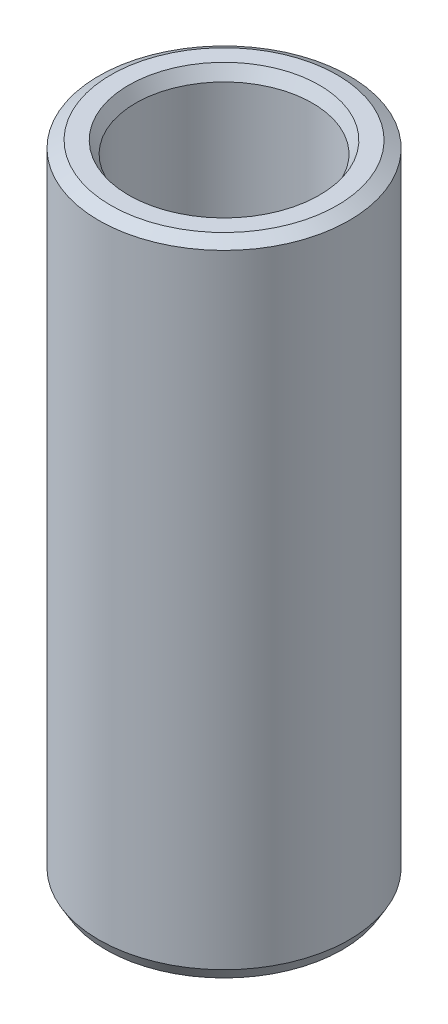
from build123d import *
from OCP.BRepFilletAPI import BRepFilletAPI_MakeChamfer

# Parameters (mm, degrees)
SKETCH1_R           = 45
BOSS_EXTRUDE1_DEPTH = 230.687205586
SKETCH2_R           = 31.759834781
CUT_EXTRUDE1_DEPTH  = 240.304381116
CHAMFER1_SIZE       = 2.504904957
CHAMFER1_SIZE2      = 4.338622654


with BuildPart() as part:
    # Sketch1 → Boss-Extrude1 (new body)
    with BuildSketch(Plane(origin=(0, 0, 0), x_dir=(1, 0, 0), z_dir=(0, 1, 0))):
        Circle(SKETCH1_R)
    extrude(amount=BOSS_EXTRUDE1_DEPTH)

    # Sketch2 → Cut-Extrude1 (cut, through all)
    with BuildSketch(Plane(origin=(0, 0, 0), x_dir=(1, 0, 0), z_dir=(0, 1, 0))):
        Circle(SKETCH2_R)
    extrude(amount=CUT_EXTRUDE1_DEPTH, mode=Mode.SUBTRACT)

    # Chamfer1: one chamfer whose edges measure the first distance from different faces: ONE call of the kernel's chamfer builder (chamfer() names one face for all edges)
    chamfer1_edges_1 = [part.edges().sort_by_distance(p)[0] for p in [
        (-31.759834781, 230.687205586, 0),
    ]]
    chamfer1_side_1 = [part.faces().sort_by_distance(p)[0] for p in [
        (-43.727207794, 230.687205586, 0),
    ]]
    chamfer1_edges_2 = [part.edges().sort_by_distance(p)[0] for p in [
        (-31.759834781, 0, 0),
    ]]
    chamfer1_side_2 = [part.faces().sort_by_distance(p)[0] for p in [
        (-31.759834781, 115.343602793, 0),
    ]]
    chamfer1_edges_3 = [part.edges().sort_by_distance(p)[0] for p in [
        (-45, 0, 0),
    ]]
    chamfer1_side_3 = [part.faces().sort_by_distance(p)[0] for p in [
        (-43.727207794, 0, 0),
    ]]
    chamfer1_edges_4 = [part.edges().sort_by_distance(p)[0] for p in [
        (-45, 230.687205586, 0),
    ]]
    chamfer1_side_4 = [part.faces().sort_by_distance(p)[0] for p in [
        (-45, 115.343602793, 0),
    ]]
    chamfer1 = BRepFilletAPI_MakeChamfer(part.part.solid().wrapped)
    for e in chamfer1_edges_1:
        chamfer1.Add(CHAMFER1_SIZE, CHAMFER1_SIZE2, e.wrapped, chamfer1_side_1[0].wrapped)  # the first distance lies on this face
    for e in chamfer1_edges_2:
        chamfer1.Add(CHAMFER1_SIZE, CHAMFER1_SIZE2, e.wrapped, chamfer1_side_2[0].wrapped)  # the first distance lies on this face
    for e in chamfer1_edges_3:
        chamfer1.Add(CHAMFER1_SIZE, CHAMFER1_SIZE2, e.wrapped, chamfer1_side_3[0].wrapped)  # the first distance lies on this face
    for e in chamfer1_edges_4:
        chamfer1.Add(CHAMFER1_SIZE, CHAMFER1_SIZE2, e.wrapped, chamfer1_side_4[0].wrapped)  # the first distance lies on this face
    add(Compound.cast(chamfer1.Shape()), mode=Mode.REPLACE)


solid = part.part
